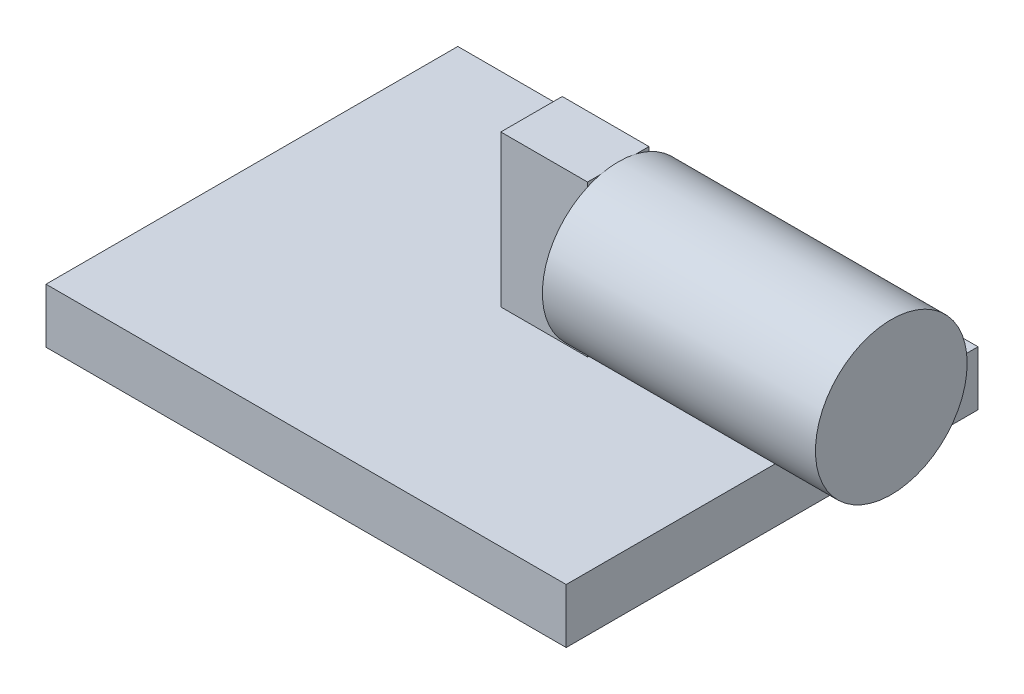
from build123d import *

# Parameters (mm, degrees)
SKETCH1_W           = 19.05
SKETCH1_H           = 15.08125
BOARD_DEPTH         = 2
SKETCH2_R           = 2.778125
LASERBARREL_DEPTH   = 10
SKETCH4_W           = 2.25
SKETCH4_H           = 5.55
BOSS_EXTRUDE3_DEPTH = 3.175


with BuildPart() as part:
    # Sketch1 → Board (new body)
    with BuildSketch(Plane(origin=(0, 0, 0), x_dir=(1, 0, 0), z_dir=(0, 1, 0))):
        Rectangle(SKETCH1_W, SKETCH1_H)
    extrude(amount=BOARD_DEPTH)



with BuildPart() as body_2:
    # Sketch2 → LaserBarrel (new body)
    with BuildSketch(Plane(origin=(12.7, 0, 0), x_dir=(0, 0, -1), z_dir=(1, 0, 0))):
        with Locations((1.190625, 4.85)):
            Circle(SKETCH2_R)
    extrude(amount=-LASERBARREL_DEPTH)


with BuildPart() as part_1:
    add(part.part)

    add(body_2.part)  # Boss-Extrude3 merges body 2
    # Sketch4 → Boss-Extrude3 (add)
    with BuildSketch(Plane.ZY.offset(-2.7)):
        with Locations((-1.190625, 4.775)):
            Rectangle(SKETCH4_W, SKETCH4_H)
    extrude(amount=BOSS_EXTRUDE3_DEPTH)


solid = part_1.part
